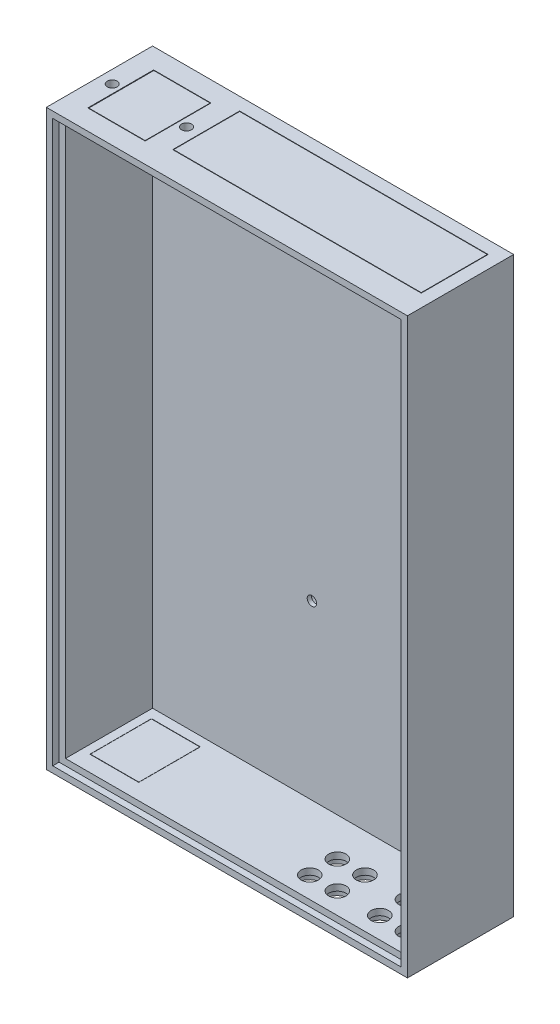
from build123d import *

# Parameters (mm, degrees)
SKETCH1_W           = 170
SKETCH1_H           = 270
BOSS_EXTRUDE1_DEPTH = 50
SKETCH2_W           = 158
SKETCH2_H           = 258
CUT_EXTRUDE1_DEPTH  = 44
SKETCH3_W           = 23
SKETCH3_H           = 29
CUT_EXTRUDE2_DEPTH  = 6
SKETCH4_W           = 28
SKETCH4_H           = 35
CUT_EXTRUDE3_DEPTH  = 4.5
CHAMFER1_SIZE       = 5
CHAMFER2_SIZE       = 5
SKETCH5_W           = 22.8
SKETCH5_H           = 28.7
BOSS_EXTRUDE2_DEPTH = 1.5
SKETCH6_W           = 0.854807692
SKETCH6_H           = 4.7625
CUT_EXTRUDE4_DEPTH  = 0.25
CUT_EXTRUDE5_DEPTH  = 0.25
CUT_EXTRUDE6_DEPTH  = 0.25
SKETCH9_W           = 117
SKETCH9_H           = 31.5
CUT_EXTRUDE7_DEPTH  = 6
SKETCH10_W          = 27
SKETCH10_H          = 31
CUT_EXTRUDE8_DEPTH  = 6
SKETCH11_R          = 2.35
CUT_EXTRUDE9_DEPTH  = 6
SKETCH12_R          = 2.35
CUT_EXTRUDE10_DEPTH = 6
SKETCH13_W          = 116.6
SKETCH13_H          = 31.1
BOSS_EXTRUDE3_DEPTH = 6
SKETCH14_W          = 26.5
SKETCH14_H          = 30.6
BOSS_EXTRUDE4_DEPTH = 6
SKETCH15_R          = 4.1
CUT_EXTRUDE11_DEPTH = 6
SKETCH16_R          = 5.75
CUT_EXTRUDE12_DEPTH = 3
CUT_EXTRUDE13_DEPTH = 0.25
SKETCH18_W          = 2.289663461
SKETCH18_H          = 1.102430555
CUT_EXTRUDE14_DEPTH = 0.25
SKETCH19_R          = 2.2
CUT_EXTRUDE15_DEPTH = 10
SKETCH20_R          = 3.75
CUT_EXTRUDE16_DEPTH = 4
SKETCH21_W          = 164
SKETCH21_H          = 264
CUT_EXTRUDE17_DEPTH = 3


with BuildPart() as part:
    # Sketch1 → Boss-Extrude1 (new body)
    with BuildSketch(Plane.XY):
        with Locations((42.589098532, -74.769392034)):
            Rectangle(SKETCH1_W, SKETCH1_H)
    extrude(amount=BOSS_EXTRUDE1_DEPTH)

    # Sketch2 → Cut-Extrude1 (cut)
    with BuildSketch(Plane.XY.offset(50)):
        with Locations((42.589098532, -74.769392034)):
            Rectangle(SKETCH2_W, SKETCH2_H)
    extrude(amount=-CUT_EXTRUDE1_DEPTH, mode=Mode.SUBTRACT)

    # Sketch3 → Cut-Extrude2 (cut)
    with BuildSketch(Plane.XZ.offset(209.769392034)):
        with Locations((-20.910901468, 25)):
            Rectangle(SKETCH3_W, SKETCH3_H)
    extrude(amount=-CUT_EXTRUDE2_DEPTH, mode=Mode.SUBTRACT)

    # Sketch4 → Cut-Extrude3 (cut)
    with BuildSketch(Plane.XZ.offset(209.769392034)):
        with Locations((-20.910901468, 25)):
            Rectangle(SKETCH4_W, SKETCH4_H)
    extrude(amount=-CUT_EXTRUDE3_DEPTH, mode=Mode.SUBTRACT)

    # Chamfer1
    # the kernel refuses this chamfer: 5 mm, written as the material it takes off along each edge
    with BuildSketch(Plane(origin=(-34.910901468, -209.769392034, 42.5), x_dir=(0, -0.0274958766105877, 0.9996219169112968), z_dir=(1, 0, 0))) as chamfer1_piece_1_section:
        Polygon((CHAMFER1_SIZE * 0.999621916911, -CHAMFER1_SIZE * 0.0274958766106), (-CHAMFER1_SIZE * 0.0274958766106, -CHAMFER1_SIZE * 0.999621916911), (0, 0), align=None)
    chamfer1_piece_1 = extrude(amount=28, mode=Mode.PRIVATE)
    chamfer1_piece_1 = split(chamfer1_piece_1, bisect_by=Plane(origin=(-20.910901468, -205.269392034, 44.179503735), z_dir=(0, -1, 0)), keep=Keep.TOP, mode=Mode.PRIVATE)
    add(chamfer1_piece_1, mode=Mode.SUBTRACT)

    # Chamfer2
    # the kernel refuses this chamfer: 5 mm, written as the material it takes off along each edge
    with BuildSketch(Plane(origin=(-6.910901468, -209.769392034, 7.5), x_dir=(0, 0.9996219169112968, 0.027495876610586282), z_dir=(-1, 0, 0))) as chamfer2_piece_1_section:
        Polygon((CHAMFER2_SIZE * 0.999621916911, CHAMFER2_SIZE * 0.0274958766106), (-CHAMFER2_SIZE * 0.0274958766106, CHAMFER2_SIZE * 0.999621916911), (0, 0), align=None)
    chamfer2_piece_1 = extrude(amount=28, mode=Mode.PRIVATE)
    chamfer2_piece_1 = split(chamfer2_piece_1, bisect_by=Plane(origin=(-20.910901468, -205.269392034, 5.820496265), z_dir=(0, -1, 0)), keep=Keep.TOP, mode=Mode.PRIVATE)
    add(chamfer2_piece_1, mode=Mode.SUBTRACT)

    # Sketch6 → Cut-Extrude4 (cut)
    with BuildSketch(Plane(origin=(0, -81.134696017, -81.134696017), x_dir=(1, 0, 0), z_dir=(0, -0.7071067811865436, -0.7071067811865515))):
        with Locations((-21.390321893, 178.542117658)):
            Rectangle(SKETCH6_W, SKETCH6_H)
    extrude(amount=-CUT_EXTRUDE4_DEPTH, mode=Mode.SUBTRACT)

    # Sketch7 → Cut-Extrude5 (cut)
    with BuildSketch(Plane(origin=(0, -106.134696017, 106.134696017), x_dir=(1, 0, 0), z_dir=(0, -0.7071067811865438, 0.7071067811865513))):
        with BuildLine():
            add(Edge.make_bspline(
                [(-21.393476353, -141.192692767), (-21.358996153, -141.193204636), (-21.291198867, -141.194211105), (-21.191346227, -141.205111993), (-21.095160527, -141.221580195), (-21.002265476, -141.244547593), (-20.913329743, -141.274944127), (-20.827706036, -141.311328257), (-20.746413523, -141.355608406), (-20.668415467, -141.405625108), (-20.593741911, -141.462251105), (-20.524187582, -141.526807666), (-20.458482271, -141.597809341), (-20.398048255, -141.676329548), (-20.341547205, -141.761654063), (-20.289164774, -141.853796415), (-20.241301963, -141.95320758), (-20.197422342, -142.060066953), (-20.158185047, -142.175976309), (-20.125135522, -142.30226518), (-20.096790024, -142.438962405), (-20.072864424, -142.586408245), (-20.054780537, -142.744798691), (-20.042591634, -142.914028515), (-20.034227031, -143.093771467), (-20.03354437, -143.217073656), (-20.033193651, -143.280420632)],
                knots=[0, 0, 0, 0, 0.879237366, 1.728815576, 2.559023295, 3.367336655, 4.166867292, 4.954216142, 5.737608147, 6.525189134, 7.316157332, 8.124696809, 8.942788509, 9.781158001, 10.649253743, 11.551476218, 12.482711956, 13.461909668, 14.496590415, 15.601789533, 16.789733467, 18.056700938, 19.410929216, 20.8549011, 22.384193279, 24, 24, 24, 24], degree=3))
            add(Edge.make_bspline(
                [(-20.033193651, -143.280420632), (-20.033572684, -143.34456015), (-20.034309138, -143.469182083), (-20.042243915, -143.650569056), (-20.055907975, -143.82102759), (-20.073519201, -143.98054005), (-20.097641764, -144.129022201), (-20.125892638, -144.26685851), (-20.15946384, -144.393999017), (-20.199993599, -144.510157245), (-20.243607615, -144.617204287), (-20.291601352, -144.716421623), (-20.343138286, -144.808077991), (-20.397036315, -144.893556151), (-20.456250328, -144.97033625), (-20.51789821, -145.041029213), (-20.584664222, -145.102942254), (-20.653737256, -145.159266095), (-20.727647737, -145.207941196), (-20.805633445, -145.250511637), (-20.88908473, -145.28504132), (-20.976480417, -145.315073395), (-21.069310184, -145.336633184), (-21.166098977, -145.353740168), (-21.267939524, -145.363194537), (-21.33727667, -145.364367413), (-21.37280578, -145.364968408)],
                knots=[0, 0, 0, 0, 1.643780988, 3.193836972, 4.651895693, 6.025988579, 7.305620092, 8.505800249, 9.631074763, 10.672816429, 11.65661981, 12.592235626, 13.49536222, 14.350718032, 15.179365177, 15.97804903, 16.751647189, 17.51006938, 18.259804725, 19.016521909, 19.783502495, 20.571750527, 21.382245291, 22.22305063, 23.089471752, 24, 24, 24, 24], degree=3))
            add(Edge.make_bspline(
                [(-21.37280578, -145.364968408), (-21.408333932, -145.364355821), (-21.477933057, -145.363155771), (-21.580048991, -145.353810465), (-21.677350716, -145.336563883), (-21.770914916, -145.314907875), (-21.860090396, -145.285107769), (-21.945304752, -145.249544982), (-22.025902759, -145.20724016), (-22.102107579, -145.15845165), (-22.173659028, -145.102504659), (-22.241669015, -145.039997602), (-22.305987098, -144.971088918), (-22.36563484, -144.895006774), (-22.421589097, -144.812766706), (-22.473266355, -144.723429575), (-22.520635559, -144.627125451), (-22.565178424, -144.523720098), (-22.603880536, -144.410987316), (-22.638323618, -144.287920417), (-22.666538486, -144.153493535), (-22.68923077, -144.007749858), (-22.707348276, -143.850998149), (-22.720825619, -143.683162749), (-22.728804469, -143.504165484), (-22.7295332, -143.381131747), (-22.729908394, -143.317786667)],
                knots=[0, 0, 0, 0, 0.917216111, 1.796812873, 2.643793957, 3.46689424, 4.273913431, 5.068098542, 5.848489301, 6.620921603, 7.401012384, 8.190319798, 9.003608147, 9.831726257, 10.68377682, 11.569763213, 12.493818149, 13.453288342, 14.474581811, 15.568529029, 16.750744269, 18.018426408, 19.375425659, 20.823733699, 22.36466933, 24, 24, 24, 24], degree=3))
            add(Edge.make_bspline(
                [(-22.729908394, -143.317786667), (-22.729228765, -143.229773666), (-22.727917413, -143.059951445), (-22.711298986, -142.814607712), (-22.686907351, -142.587829931), (-22.651081816, -142.379997444), (-22.606784038, -142.190340502), (-22.550058427, -142.020108464), (-22.485480445, -141.866945789), (-22.430451708, -141.776211298), (-22.40394936, -141.732512729)],
                knots=[0, 0, 0, 0, 1.288568992, 2.486310467, 3.599230591, 4.627010532, 5.572937695, 6.447898582, 7.252493626, 8, 8, 8, 8], degree=3))
            add(Edge.make_bspline(
                [(-22.40394936, -141.732512729), (-22.373133692, -141.689583269), (-22.31288299, -141.605647715), (-22.207532952, -141.495456023), (-22.094348053, -141.401214691), (-21.971003539, -141.325056487), (-21.839450156, -141.264998121), (-21.698558449, -141.222579573), (-21.54884871, -141.197864551), (-21.446040535, -141.194442439), (-21.393476353, -141.192692767)],
                knots=[0, 0, 0, 0, 1.058512271, 2.069600068, 3.047294572, 4.004278952, 4.967380941, 5.939006123, 6.946246673, 8, 8, 8, 8], degree=3))
        make_face()
        with BuildLine():
            add(Edge.make_bspline(
                [(-21.375985868, -141.905032511), (-21.407156255, -141.906509925), (-21.46826676, -141.909406442), (-21.556941013, -141.933993779), (-21.640555298, -141.971970248), (-21.704158451, -142.017668991), (-21.751764779, -142.061476716), (-21.785027661, -142.101121283), (-21.817104469, -142.145361762), (-21.845436321, -142.196194499), (-21.872188984, -142.251793013), (-21.8983344, -142.312409689), (-21.919766776, -142.379533404), (-21.940823518, -142.452021031), (-21.959271188, -142.531876661), (-21.974726291, -142.619753025), (-21.988534067, -142.716221593), (-21.998165156, -142.82134555), (-22.00714422, -142.935014911), (-22.013580839, -143.057482888), (-22.016271828, -143.188716441), (-22.017127212, -143.279095042), (-22.017568651, -143.325736888)],
                knots=[0, 0, 0, 0, 1.076674018, 2.110852608, 3.161083442, 4.239746716, 4.804137807, 5.395870207, 6.026861976, 6.692161227, 7.405688833, 8.16177676, 8.973626916, 9.841385931, 10.773283133, 11.807421078, 12.927755683, 14.143907515, 15.458935494, 16.872852025, 18.386167141, 20, 20, 20, 20], degree=3))
            add(Edge.make_bspline(
                [(-22.017568651, -143.325736888), (-22.016842095, -143.386163654), (-22.015448871, -143.50203646), (-22.008151815, -143.668665588), (-21.993525472, -143.820311513), (-21.975333254, -143.958001994), (-21.94978154, -144.080844071), (-21.92038264, -144.189999946), (-21.884077612, -144.284078144), (-21.842120158, -144.36443925), (-21.795650386, -144.432802275), (-21.745205404, -144.490911155), (-21.692502684, -144.541230703), (-21.635897202, -144.582104651), (-21.575524001, -144.613428562), (-21.511887087, -144.635959463), (-21.44494602, -144.649751567), (-21.399105467, -144.651664088), (-21.375985868, -144.652628665)],
                knots=[0, 0, 0, 0, 1.771748488, 3.397459088, 4.888034009, 6.237357457, 7.467047327, 8.564189669, 9.548206622, 10.417051504, 11.216568818, 11.965764335, 12.669334354, 13.348544111, 14.005342236, 14.656555988, 15.322436492, 16, 16, 16, 16], degree=3))
            add(Edge.make_bspline(
                [(-21.375985868, -144.652628665), (-21.353659661, -144.65196863), (-21.309947724, -144.650676363), (-21.246205931, -144.637411422), (-21.185927161, -144.615845509), (-21.129293416, -144.585339011), (-21.076102125, -144.546545331), (-21.026613254, -144.499293994), (-20.981200038, -144.443114012), (-20.954742092, -144.401420158), (-20.941108815, -144.379936107)],
                knots=[0, 0, 0, 0, 0.992283464, 1.942767638, 2.88273346, 3.832339453, 4.79467288, 5.803907806, 6.868395428, 8, 8, 8, 8], degree=3))
            add(Edge.make_bspline(
                [(-20.941108815, -144.379936107), (-20.925057928, -144.350578838), (-20.891400519, -144.289019025), (-20.852452108, -144.185139137), (-20.819667506, -144.067979792), (-20.791450278, -143.93717638), (-20.772151416, -143.792212995), (-20.755531259, -143.634008863), (-20.747514944, -143.461767332), (-20.746211047, -143.342437778), (-20.745533394, -143.280420632)],
                knots=[0, 0, 0, 0, 0.710965849, 1.490837728, 2.352621235, 3.297892224, 4.334225155, 5.461620853, 6.680770821, 8, 8, 8, 8], degree=3))
            add(Edge.make_bspline(
                [(-20.745533394, -143.280420632), (-20.745795157, -143.217865147), (-20.746299005, -143.097456518), (-20.755543162, -142.924595767), (-20.768416356, -142.766716159), (-20.787246123, -142.624170176), (-20.81147404, -142.496611778), (-20.84133504, -142.384049305), (-20.876538937, -142.286260917), (-20.918286564, -142.203344122), (-20.964524655, -142.132876221), (-21.0136078, -142.072420228), (-21.065743542, -142.020804427), (-21.120844694, -141.977834577), (-21.180186591, -141.945002389), (-21.242635726, -141.921820149), (-21.308320123, -141.907795671), (-21.353126181, -141.905965996), (-21.375985868, -141.905032511)],
                knots=[0, 0, 0, 0, 1.793836731, 3.452829483, 4.963243077, 6.335886805, 7.574563692, 8.684454726, 9.672768357, 10.54971625, 11.340229787, 12.085688095, 12.778991901, 13.440269426, 14.083255152, 14.715733572, 15.344777694, 16, 16, 16, 16], degree=3))
        make_face(mode=Mode.SUBTRACT)
    extrude(amount=-CUT_EXTRUDE5_DEPTH, mode=Mode.SUBTRACT)

    # Sketch8 → Cut-Extrude6 (cut)
    # profile 1 of 5: a face of its own
    with BuildSketch(Plane.XZ.offset(209.769392034)):
        Polygon((11.588851494, 27.702942042), (13.056992185, 27.702942042), (13.056992185, 22.411275375), (12.107205861, 22.411275375), (12.107205861, 26.820997597), (11.021735775, 26.820997597), align=None)
    # profile 2 of 5: a face of its own
    with BuildSketch(Plane.XZ.offset(209.769392034)):
        with BuildLine():
            Line((15.702825519, 25.939053153), (14.753039194, 25.939053153))
            add(Edge.make_bspline(
                [(14.753039194, 25.939053153), (14.757141175, 26.010899464), (14.765156201, 26.151282841), (14.797037947, 26.355194192), (14.839758392, 26.547867995), (14.896774497, 26.728630258), (14.968418964, 26.897415296), (15.052848195, 27.054798506), (15.152219167, 27.199951264), (15.264416938, 27.33217356), (15.387536698, 27.450791402), (15.51902236, 27.555965433), (15.660885175, 27.642752396), (15.810533193, 27.714170031), (15.967940932, 27.771229404), (16.134597716, 27.809378212), (16.309060541, 27.835212958), (16.428494473, 27.837473602), (16.489367319, 27.838625802)],
                knots=[0, 0, 0, 0, 1.199038563, 2.342849363, 3.436047546, 4.486744587, 5.497670872, 6.488682221, 7.459191391, 8.424610317, 9.374430501, 10.305433194, 11.225809216, 12.140057399, 13.06607119, 14.010487599, 14.985989317, 16, 16, 16, 16], degree=3))
            add(Edge.make_bspline(
                [(16.489367319, 27.838625802), (16.564087874, 27.836294324), (16.709959908, 27.831742732), (16.921923544, 27.792916142), (17.119874405, 27.727972669), (17.303668599, 27.637229511), (17.471741453, 27.52194984), (17.624065097, 27.3844977), (17.756033021, 27.221989273), (17.86848194, 27.041186268), (17.961913552, 26.849741331), (18.027386534, 26.651779328), (18.07042122, 26.452553367), (18.075011136, 26.318404689), (18.077291331, 26.25176182)],
                knots=[0, 0, 0, 0, 1.075374347, 2.099382735, 3.09057751, 4.06680945, 5.040638231, 6.016817125, 7.011024321, 8.044445721, 9.0776792, 10.070479129, 11.0414456, 12, 12, 12, 12], degree=3))
            add(Edge.make_bspline(
                [(18.077291331, 26.25176182), (18.076403543, 26.211451503), (18.074616646, 26.130316792), (18.062192114, 26.007540061), (18.043552861, 25.882477606), (18.015449409, 25.755236657), (17.980402101, 25.625781545), (17.937884651, 25.493724857), (17.886910824, 25.359815304), (17.828331271, 25.222545759), (17.758445715, 25.081470561), (17.6770737, 24.934474937), (17.582055427, 24.781689284), (17.474538597, 24.622250924), (17.354001028, 24.456411318), (17.219854293, 24.284670024), (17.07364345, 24.106421882), (16.969873501, 23.987273003), (16.916559159, 23.92605736)],
                knots=[0, 0, 0, 0, 0.728284026, 1.46585585, 2.227944881, 3.01186502, 3.81876927, 4.650621989, 5.517437689, 6.406905708, 7.346299482, 8.360816762, 9.441613733, 10.596154504, 11.834900912, 13.145207542, 14.533280747, 16, 16, 16, 16], degree=3))
            Line((16.916559159, 23.92605736), (16.364283852, 23.29321982))
            Line((16.364283852, 23.29321982), (18.145133211, 23.29321982))
            Line((18.145133211, 23.29321982), (18.145133211, 22.411275375))
            Line((18.145133211, 22.411275375), (14.617355433, 22.411275375))
            Line((14.617355433, 22.411275375), (14.617355433, 22.892528714))
            Line((14.617355433, 22.892528714), (16.184078857, 24.559954929))
            add(Edge.make_bspline(
                [(16.184078857, 24.559954929), (16.229439527, 24.608594269), (16.317289691, 24.702794248), (16.442291422, 24.841136938), (16.555406946, 24.972420848), (16.654290721, 25.098043888), (16.744132041, 25.213931357), (16.820924887, 25.323576248), (16.885371856, 25.425987332), (16.95533818, 25.549477214), (17.021783189, 25.696760872), (17.082750506, 25.866437686), (17.119914305, 26.028609642), (17.125044084, 26.134284375), (17.127505006, 26.184979969)],
                knots=[0, 0, 0, 0, 1.246127091, 2.413378631, 3.493388633, 4.492180848, 5.408488754, 6.240484944, 6.999099869, 7.674939598, 8.898438119, 10.020720584, 11.050475521, 12, 12, 12, 12], degree=3))
            add(Edge.make_bspline(
                [(17.127505006, 26.184979969), (17.125665034, 26.234024045), (17.122099794, 26.329054806), (17.082920698, 26.464235556), (17.022223082, 26.586627926), (16.936691569, 26.692574694), (16.833086119, 26.779638178), (16.71336029, 26.844393552), (16.578490199, 26.881757106), (16.483943695, 26.886433688), (16.43530582, 26.888839478)],
                knots=[0, 0, 0, 0, 1.062038974, 2.057870785, 3.028805853, 4.01125022, 4.991535629, 5.949134679, 6.94496649, 8, 8, 8, 8], degree=3))
            add(Edge.make_bspline(
                [(16.43530582, 26.888839478), (16.410178875, 26.88795075), (16.360712448, 26.886201147), (16.288000666, 26.874554514), (16.218810182, 26.854028538), (16.152370867, 26.82652662), (16.089391778, 26.79007263), (16.03003177, 26.74513728), (15.973665408, 26.692862478), (15.920551213, 26.633411682), (15.872210361, 26.567064575), (15.829274194, 26.494427104), (15.793773131, 26.415544357), (15.762516705, 26.331457706), (15.738410253, 26.241263992), (15.720857766, 26.145503014), (15.707513782, 26.044330563), (15.704416702, 25.974784017), (15.702825519, 25.939053153)],
                knots=[0, 0, 0, 0, 0.903469896, 1.778625579, 2.63899355, 3.493148037, 4.358286772, 5.247621495, 6.164656832, 7.118446693, 8.109501108, 9.111810964, 10.146451449, 11.215617525, 12.33435995, 13.498009769, 14.714554818, 16, 16, 16, 16], degree=3))
        make_face()
    # profile 3 of 5: a face of its own
    with BuildSketch(Plane.XZ.offset(209.769392034)):
        Polygon((18.721789194, 27.702942042), (19.736237311, 27.702942042), (21.096255006, 23.944077859), (22.459452789, 27.702942042), (23.470720818, 27.702942042), (21.552067639, 22.411275375), (20.637262284, 22.411275375), align=None)
    # profile 4 of 5: a face of its own
    with BuildSketch(Plane.XZ.offset(209.769392034)):
        with BuildLine():
            Line((26.354000732, 27.702942042), (27.414030113, 27.702942042))
            add(Edge.make_bspline(
                [(27.414030113, 27.702942042), (27.483291057, 27.702632015), (27.616909937, 27.702033908), (27.809599356, 27.694781071), (27.987364779, 27.681783544), (28.150165365, 27.665720657), (28.297934175, 27.643201114), (28.43085626, 27.617384221), (28.548959204, 27.585931732), (28.653574793, 27.548598063), (28.747463905, 27.504583126), (28.836313288, 27.457704076), (28.918114934, 27.401755583), (28.996997621, 27.342767539), (29.068451488, 27.275104837), (29.136934257, 27.20327053), (29.199545495, 27.124415727), (29.25657532, 27.039494944), (29.308310158, 26.950077155), (29.353509174, 26.856002507), (29.390172084, 26.757122136), (29.420927707, 26.654075687), (29.445630923, 26.54686765), (29.46207417, 26.434838686), (29.47324325, 26.318771025), (29.474228767, 26.239775301), (29.474727228, 26.19982038)],
                knots=[0, 0, 0, 0, 1.698747864, 3.27724071, 4.728299578, 6.070144658, 7.288476769, 8.393259625, 9.389771311, 10.283485332, 11.113357557, 11.931608583, 12.74405601, 13.541433047, 14.344816069, 15.154114104, 15.974336324, 16.810834471, 17.661136416, 18.50621059, 19.367396281, 20.244825668, 21.142564693, 22.063065223, 23.020325768, 24, 24, 24, 24], degree=3))
            add(Edge.make_bspline(
                [(29.474727228, 26.19982038), (29.474006018, 26.155619203), (29.472588751, 26.068758458), (29.458694972, 25.941431263), (29.434960007, 25.82003631), (29.40393965, 25.703549855), (29.360683967, 25.593888357), (29.311266382, 25.48843526), (29.250467076, 25.390147145), (29.18099415, 25.297794545), (29.105121789, 25.210626591), (29.021048786, 25.131160093), (28.930377609, 25.05885333), (28.833633121, 24.992948521), (28.730452115, 24.933578611), (28.620909039, 24.880187665), (28.504255873, 24.83448329), (28.423022118, 24.810580272), (28.381836937, 24.79846154)],
                knots=[0, 0, 0, 0, 1.102006807, 2.165578795, 3.188629044, 4.184801286, 5.166646146, 6.124351954, 7.085497154, 8.042432466, 9.003981491, 9.963833307, 10.922997304, 11.89326795, 12.880200226, 13.889073926, 14.929769137, 16, 16, 16, 16], degree=3))
            add(Edge.make_bspline(
                [(28.381836937, 24.79846154), (28.354710008, 24.791712316), (28.295944344, 24.777091323), (28.19870331, 24.762247346), (28.086643229, 24.748599222), (27.959401737, 24.736870312), (27.816905476, 24.728897386), (27.659292419, 24.722670885), (27.486491139, 24.718143576), (27.366331962, 24.717982927), (27.303787057, 24.717899307)],
                knots=[0, 0, 0, 0, 0.618981996, 1.340914327, 2.176866532, 3.120127938, 4.170906482, 5.338178032, 6.614476169, 8, 8, 8, 8], degree=3))
            Line((27.303787057, 24.717899307), (27.303787057, 22.411275375))
            Line((27.303787057, 22.411275375), (26.354000732, 22.411275375))
            Line((26.354000732, 22.411275375), (26.354000732, 27.702942042))
        make_face()
        with BuildLine():
            Line((27.303787057, 25.667685631), (27.639816371, 25.667685631))
            add(Edge.make_bspline(
                [(27.639816371, 25.667685631), (27.700962209, 25.668073344), (27.813471461, 25.66878674), (27.967119368, 25.67910286), (28.090593782, 25.69485766), (28.188140862, 25.717453687), (28.26516352, 25.751746149), (28.331590741, 25.79141607), (28.388567065, 25.841577597), (28.437900175, 25.898895724), (28.477340509, 25.964757124), (28.504690327, 26.038089373), (28.522456231, 26.117351682), (28.524097077, 26.172513003), (28.524940903, 26.20088041)],
                knots=[0, 0, 0, 0, 1.8619151, 3.425951444, 4.686033666, 5.651700536, 6.461346321, 7.243864085, 7.999046032, 8.762387399, 9.539336099, 10.322741239, 11.137448474, 12, 12, 12, 12], degree=3))
            add(Edge.make_bspline(
                [(28.524940903, 26.20088041), (28.524105757, 26.225664644), (28.522485373, 26.273752016), (28.510581591, 26.343154022), (28.491610385, 26.407851009), (28.464121838, 26.467167302), (28.428585655, 26.521002113), (28.385259858, 26.569334235), (28.334700399, 26.613198742), (28.295665542, 26.636416895), (28.275833999, 26.648212808)],
                knots=[0, 0, 0, 0, 1.102301479, 2.1387299, 3.123554645, 4.094223062, 5.036071848, 5.982632524, 6.975082478, 8, 8, 8, 8], degree=3))
            add(Edge.make_bspline(
                [(28.275833999, 26.648212808), (28.259035537, 26.656708272), (28.223469752, 26.67469491), (28.162897771, 26.695605691), (28.09299863, 26.713246239), (28.013300431, 26.727887723), (27.924121112, 26.739251035), (27.825476586, 26.747941126), (27.717221687, 26.75143575), (27.641936883, 26.752566582), (27.602715342, 26.753155717)],
                knots=[0, 0, 0, 0, 0.656809284, 1.390599849, 2.23162475, 3.173112763, 4.218524733, 5.370385145, 6.63003504, 8, 8, 8, 8], degree=3))
            Line((27.602715342, 26.753155717), (27.303787057, 26.753155717))
            Line((27.303787057, 26.753155717), (27.303787057, 25.667685631))
        make_face(mode=Mode.SUBTRACT)
    # profile 5 of 5: a face of its own
    with BuildSketch(Plane.XZ.offset(209.769392034)):
        with BuildLine():
            Line((33.138188767, 26.995902445), (32.427969082, 26.346104435))
            add(Edge.make_bspline(
                [(32.427969082, 26.346104435), (32.397546316, 26.389018909), (32.339138848, 26.471408715), (32.244466434, 26.581730607), (32.150221515, 26.67584339), (32.055530969, 26.753353906), (31.959555494, 26.81379122), (31.86246169, 26.856581507), (31.764800009, 26.883783697), (31.699186435, 26.887171025), (31.666867987, 26.888839478)],
                knots=[0, 0, 0, 0, 1.299362458, 2.494594718, 3.587462134, 4.587049575, 5.512617175, 6.380583204, 7.202344345, 8, 8, 8, 8], degree=3))
            add(Edge.make_bspline(
                [(31.666867987, 26.888839478), (31.636722265, 26.887782269), (31.578518796, 26.885741078), (31.495545434, 26.865451786), (31.421880501, 26.830435449), (31.357595892, 26.784648641), (31.306672997, 26.729486153), (31.266015014, 26.671634887), (31.243121153, 26.607780173), (31.240107871, 26.563922179), (31.238616117, 26.54220987)],
                knots=[0, 0, 0, 0, 1.185010067, 2.2879431, 3.333075148, 4.379039566, 5.372662701, 6.27520591, 7.14612461, 8, 8, 8, 8], degree=3))
            add(Edge.make_bspline(
                [(31.238616117, 26.54220987), (31.239550923, 26.520184461), (31.241433493, 26.475828346), (31.259616558, 26.410818936), (31.287023628, 26.347297175), (31.313212203, 26.308628457), (31.326598556, 26.288862848)],
                knots=[0, 0, 0, 0, 0.967525499, 1.948461899, 2.951351359, 4, 4, 4, 4], degree=3))
            add(Edge.make_bspline(
                [(31.326598556, 26.288862848), (31.338768198, 26.273499248), (31.366781109, 26.238134268), (31.420195992, 26.182121652), (31.487273868, 26.113501296), (31.570596033, 26.03463285), (31.666703556, 25.942679899), (31.780051145, 25.841257147), (31.907376161, 25.72722365), (31.997875833, 25.647814852), (32.045298475, 25.606203927)],
                knots=[0, 0, 0, 0, 0.473873513, 1.090794244, 1.870441696, 2.795289791, 3.865433203, 5.087734844, 6.473946851, 8, 8, 8, 8], degree=3))
            add(Edge.make_bspline(
                [(32.045298475, 25.606203927), (32.089811447, 25.567680196), (32.174287819, 25.494570157), (32.294480921, 25.390802195), (32.40011064, 25.29744469), (32.492715759, 25.215898738), (32.570892476, 25.145308735), (32.634969445, 25.085337263), (32.685729259, 25.037151855), (32.71458324, 25.008047839), (32.726897367, 24.995627004)],
                knots=[0, 0, 0, 0, 1.543621617, 2.929473131, 4.163658386, 5.240097082, 6.164993805, 6.925417477, 7.541396219, 8, 8, 8, 8], degree=3))
            add(Edge.make_bspline(
                [(32.726897367, 24.995627004), (32.773614596, 24.945068957), (32.863421516, 24.847878636), (32.980138854, 24.697264203), (33.076200998, 24.550233806), (33.150516494, 24.404020828), (33.206642546, 24.256515709), (33.246212156, 24.104100892), (33.269910659, 23.945183739), (33.272541746, 23.836742182), (33.273872527, 23.781893364)],
                knots=[0, 0, 0, 0, 1.206664779, 2.319633467, 3.337109185, 4.282041471, 5.190008762, 6.099243693, 7.03861361, 8, 8, 8, 8], degree=3))
            add(Edge.make_bspline(
                [(33.273872527, 23.781893364), (33.272925311, 23.728449917), (33.271066838, 23.623591886), (33.248304102, 23.470147776), (33.215845777, 23.323295103), (33.165659512, 23.184631832), (33.10449279, 23.051881848), (33.02781147, 22.927112973), (32.937759774, 22.809062495), (32.834546703, 22.699840711), (32.720380791, 22.600729512), (32.597927, 22.512498382), (32.465987916, 22.439652345), (32.325690805, 22.37966883), (32.177110764, 22.333468725), (32.020424799, 22.299322542), (31.855393246, 22.27882854), (31.742542292, 22.276686136), (31.684888486, 22.275591614)],
                knots=[0, 0, 0, 0, 1.043214005, 2.046824704, 3.02475056, 3.976699089, 4.921714032, 5.875962561, 6.831408892, 7.817874052, 8.806269674, 9.781291748, 10.760897367, 11.74438705, 12.757449933, 13.795994037, 14.874007457, 16, 16, 16, 16], degree=3))
            add(Edge.make_bspline(
                [(31.684888486, 22.275591614), (31.639630739, 22.276394517), (31.549994445, 22.277984725), (31.417884099, 22.290967446), (31.290316625, 22.311920176), (31.167435718, 22.341951699), (31.048687777, 22.380005711), (30.934067924, 22.426487228), (30.82436742, 22.482116698), (30.718756217, 22.545750156), (30.617747717, 22.619636984), (30.520064707, 22.702266588), (30.426677467, 22.794909849), (30.337137478, 22.89734767), (30.252017641, 23.009870129), (30.168531679, 23.130910144), (30.090389958, 23.262714052), (30.042118341, 23.35517556), (30.017462271, 23.402402846)],
                knots=[0, 0, 0, 0, 1.016823716, 2.013894106, 2.979844003, 3.91962641, 4.853723003, 5.779685073, 6.695824784, 7.614987388, 8.547259901, 9.504950863, 10.487499108, 11.500346958, 12.559593716, 13.656357062, 14.802919212, 16, 16, 16, 16], degree=3))
            Line((30.017462271, 23.402402846), (30.852765422, 23.903796743))
            add(Edge.make_bspline(
                [(30.852765422, 23.903796743), (30.883606481, 23.850187603), (30.942731427, 23.7474143), (31.042924175, 23.609325342), (31.145566531, 23.491075007), (31.253031493, 23.394753378), (31.364012328, 23.31907251), (31.479045099, 23.264985712), (31.598210626, 23.231506045), (31.67938077, 23.227417404), (31.719869456, 23.225377939)],
                knots=[0, 0, 0, 0, 1.283663364, 2.460892379, 3.537111102, 4.529833553, 5.449777664, 6.316464042, 7.160231139, 8, 8, 8, 8], degree=3))
            add(Edge.make_bspline(
                [(31.719869456, 23.225377939), (31.761052246, 23.227043477), (31.840952857, 23.230274863), (31.955000755, 23.260122202), (32.059564186, 23.306984714), (32.149948044, 23.373851057), (32.226479396, 23.451024979), (32.282963927, 23.536884496), (32.31844789, 23.629782421), (32.322199405, 23.69431543), (32.324086202, 23.726771836)],
                knots=[0, 0, 0, 0, 1.13588714, 2.203786484, 3.234766741, 4.283437687, 5.291419208, 6.222934724, 7.106237994, 8, 8, 8, 8], degree=3))
            add(Edge.make_bspline(
                [(32.324086202, 23.726771836), (32.322343822, 23.75696724), (32.318804344, 23.818306313), (32.292733639, 23.90950765), (32.251977176, 24.000667511), (32.203759405, 24.075439295), (32.154691786, 24.138043684), (32.107772075, 24.192287554), (32.050636278, 24.252217534), (31.983429268, 24.317909012), (31.907039023, 24.389940286), (31.821401195, 24.468304302), (31.725535141, 24.552310768), (31.657776824, 24.609535142), (31.622346753, 24.639457133)],
                knots=[0, 0, 0, 0, 0.916159276, 1.861089862, 2.860218735, 3.940849679, 4.552606315, 5.27541173, 6.11797699, 7.06649574, 8.129236253, 9.306560635, 10.591630461, 12, 12, 12, 12], degree=3))
            add(Edge.make_bspline(
                [(31.622346753, 24.639457133), (31.554992777, 24.696445055), (31.425720111, 24.805822127), (31.243041432, 24.967368619), (31.078431586, 25.118348618), (30.93331232, 25.260628567), (30.805834589, 25.391580885), (30.696861729, 25.512269217), (30.607590856, 25.623624508), (30.513652511, 25.755517399), (30.424392301, 25.916237949), (30.34724615, 26.109603402), (30.297196984, 26.30294432), (30.291589671, 26.432742763), (30.288829792, 26.496628607)],
                knots=[0, 0, 0, 0, 1.345494975, 2.582412109, 3.71882943, 4.751509156, 5.681369928, 6.505683931, 7.230279997, 7.856715994, 8.973648664, 10.023341002, 11.027102913, 12, 12, 12, 12], degree=3))
            add(Edge.make_bspline(
                [(30.288829792, 26.496628607), (30.289977622, 26.541933018), (30.29223897, 26.631187575), (30.312410542, 26.762423396), (30.342557725, 26.889054936), (30.38634009, 27.010620186), (30.443164314, 27.12696688), (30.512175126, 27.238664585), (30.594444134, 27.34468526), (30.687155752, 27.444958621), (30.789300218, 27.536597062), (30.89845456, 27.617477168), (31.014000957, 27.685789682), (31.135232552, 27.742459873), (31.262900568, 27.785837304), (31.39606448, 27.816585389), (31.534915288, 27.834873369), (31.62935861, 27.837359408), (31.67746828, 27.838625802)],
                knots=[0, 0, 0, 0, 1.010766082, 1.991317756, 2.957454644, 3.913069143, 4.869106762, 5.843196583, 6.838735724, 7.860187025, 8.887984031, 9.89767229, 10.887916223, 11.879572884, 12.879850636, 13.892031539, 14.926195476, 16, 16, 16, 16], degree=3))
            add(Edge.make_bspline(
                [(31.67746828, 27.838625802), (31.739816031, 27.836344989), (31.864019382, 27.831801366), (32.047657619, 27.796271717), (32.227027771, 27.740397602), (32.3715676, 27.672991629), (32.486575245, 27.607695432), (32.574717861, 27.547578918), (32.664407718, 27.478712221), (32.756368107, 27.400878323), (32.848890264, 27.312610731), (32.944605035, 27.216010725), (33.042208189, 27.110243455), (33.105634764, 27.034683807), (33.138188767, 26.995902445)],
                knots=[0, 0, 0, 0, 1.282922637, 2.555718331, 3.837320111, 5.142675274, 5.830281639, 6.55870424, 7.337177975, 8.157850921, 9.037902056, 9.96903443, 10.957596896, 12, 12, 12, 12], degree=3))
        make_face()
    extrude(amount=-CUT_EXTRUDE6_DEPTH, mode=Mode.SUBTRACT)

    # Sketch9 → Cut-Extrude7 (cut)
    with BuildSketch(Plane.XZ.offset(-54.230607966)):
        with Locations((63.089098532, 21.75)):
            Rectangle(SKETCH9_W, SKETCH9_H)
    extrude(amount=-CUT_EXTRUDE7_DEPTH, mode=Mode.SUBTRACT)

    # Sketch10 → Cut-Extrude8 (cut)
    with BuildSketch(Plane(origin=(0, 60.230607966, 0), x_dir=(1, 0, 0), z_dir=(0, 1, 0))):
        with Locations((-18.910901468, -25)):
            Rectangle(SKETCH10_W, SKETCH10_H)
    extrude(amount=-CUT_EXTRUDE8_DEPTH, mode=Mode.SUBTRACT)

    # Sketch11 → Cut-Extrude9 (cut)
    with BuildSketch(Plane(origin=(0, 60.230607966, 0), x_dir=(1, 0, 0), z_dir=(0, 1, 0))):
        with Locations(Location((-1.410901468, -25, 0), (0, 0, 270))):
            Circle(SKETCH11_R)
    extrude(amount=-CUT_EXTRUDE9_DEPTH, mode=Mode.SUBTRACT)

    # Sketch12 → Cut-Extrude10 (cut)
    with BuildSketch(Plane(origin=(0, 60.230607966, 0), x_dir=(1, 0, 0), z_dir=(0, 1, 0))):
        with Locations(Location((-36.410901468, -25, 0), (0, 0, 270))):
            Circle(SKETCH12_R)
    extrude(amount=-CUT_EXTRUDE10_DEPTH, mode=Mode.SUBTRACT)

    # Sketch15 → Cut-Extrude11 (cut)
    with BuildSketch(Plane.XZ.offset(209.769392034)):
        with Locations(Location((114.589098532, 37, 0), (0, 0, 270))):
            Circle(SKETCH15_R)
        with Locations(Location((101.589098532, 37, 0), (0, 0, 270))):
            Circle(SKETCH15_R)
        with Locations(Location((81.589098532, 37, 0), (0, 0, 270))):
            Circle(SKETCH15_R)
        with Locations(Location((68.589098532, 37, 0), (0, 0, 270))):
            Circle(SKETCH15_R)
        with Locations(Location((114.589098532, 24, 0), (0, 0, 270))):
            Circle(SKETCH15_R)
        with Locations(Location((101.589098532, 24, 0), (0, 0, 270))):
            Circle(SKETCH15_R)
        with Locations(Location((81.589098532, 24, 0), (0, 0, 270))):
            Circle(SKETCH15_R)
        with Locations(Location((68.589098532, 24, 0), (0, 0, 270))):
            Circle(SKETCH15_R)
    extrude(amount=-CUT_EXTRUDE11_DEPTH, mode=Mode.SUBTRACT)

    # Sketch16 → Cut-Extrude12 (cut)
    with BuildSketch(Plane.XZ.offset(209.769392034)):
        with Locations(Location((114.589098532, 37, 0), (0, 0, 270))):
            Circle(SKETCH16_R)
        with Locations(Location((114.589098532, 24, 0), (0, 0, 270))):
            Circle(SKETCH16_R)
        with Locations(Location((101.589098532, 37, 0), (0, 0, 270))):
            Circle(SKETCH16_R)
        with Locations(Location((101.589098532, 24, 0), (0, 0, 270))):
            Circle(SKETCH16_R)
        with Locations(Location((81.589098532, 37, 0), (0, 0, 270))):
            Circle(SKETCH16_R)
        with Locations(Location((68.589098532, 37, 0), (0, 0, 270))):
            Circle(SKETCH16_R)
        with Locations(Location((81.589098532, 24, 0), (0, 0, 270))):
            Circle(SKETCH16_R)
        with Locations(Location((68.589098532, 24, 0), (0, 0, 270))):
            Circle(SKETCH16_R)
    extrude(amount=-CUT_EXTRUDE12_DEPTH, mode=Mode.SUBTRACT)

    # Sketch17 → Cut-Extrude13 (cut)
    with BuildSketch(Plane.XZ.offset(209.769392034)):
        Polygon((91.179124912, 37.58846879), (91.179124912, 39.199713448), (92.281555467, 39.199713448), (92.281555467, 37.58846879), (93.977602476, 37.58846879), (93.977602476, 36.486038234), (92.281555467, 36.486038234), (92.281555467, 34.874793576), (91.179124912, 34.874793576), (91.179124912, 36.486038234), (89.483077903, 36.486038234), (89.483077903, 37.58846879), align=None)
    extrude(amount=-CUT_EXTRUDE13_DEPTH, mode=Mode.SUBTRACT)

    # Sketch18 → Cut-Extrude14 (cut)
    with BuildSketch(Plane.XZ.offset(209.769392034)):
        with Locations((91.702338998, 24.560282122)):
            Rectangle(SKETCH18_W, SKETCH18_H)
    extrude(amount=-CUT_EXTRUDE14_DEPTH, mode=Mode.SUBTRACT)

    # Sketch19 → Cut-Extrude15 (cut)
    with BuildSketch(Plane.XY.offset(6)):
        with Locations((88.589098532, 27.480607966)):
            Circle(SKETCH19_R)
        with Locations((38.589098532, 27.480607966)):
            Circle(SKETCH19_R)
        with Locations((88.589098532, -122.519392034)):
            Circle(SKETCH19_R)
        with Locations((38.589098532, -122.519392034)):
            Circle(SKETCH19_R)
    extrude(amount=-CUT_EXTRUDE15_DEPTH, mode=Mode.SUBTRACT)

    # Sketch20 → Cut-Extrude16 (cut)
    with BuildSketch(Plane(origin=(0, 0, 0), x_dir=(-1, 0, 0), z_dir=(0, 0, -1))):
        with Locations((-88.589098532, 27.480607966)):
            Circle(SKETCH20_R)
        with Locations((-38.589098532, 27.480607966)):
            Circle(SKETCH20_R)
        with Locations((-38.589098532, -122.519392034)):
            Circle(SKETCH20_R)
        with Locations((-88.589098532, -122.519392034)):
            Circle(SKETCH20_R)
    extrude(amount=-CUT_EXTRUDE16_DEPTH, mode=Mode.SUBTRACT)

    # Sketch21 → Cut-Extrude17 (cut)
    with BuildSketch(Plane.XY.offset(50)):
        with Locations((42.589098532, -74.769392034)):
            Rectangle(SKETCH21_W, SKETCH21_H)
    extrude(amount=-CUT_EXTRUDE17_DEPTH, mode=Mode.SUBTRACT)


with BuildPart() as body_2:
    # Sketch5 → Boss-Extrude2 (new body)
    with BuildSketch(Plane.XZ.offset(205.269392034)):
        with Locations((-20.910901468, 25)):
            Rectangle(SKETCH5_W, SKETCH5_H)
    extrude(amount=-BOSS_EXTRUDE2_DEPTH)


with BuildPart() as body_3:
    # Sketch13 → Boss-Extrude3 (new body)
    with BuildSketch(Plane(origin=(0, 60.230607966, 0), x_dir=(1, 0, 0), z_dir=(0, 1, 0))):
        with Locations((63.089098532, -21.75)):
            Rectangle(SKETCH13_W, SKETCH13_H)
    extrude(amount=-BOSS_EXTRUDE3_DEPTH)


with BuildPart() as body_4:
    # Sketch14 → Boss-Extrude4 (new body)
    with BuildSketch(Plane(origin=(0, 60.230607966, 0), x_dir=(1, 0, 0), z_dir=(0, 1, 0))):
        with Locations((-18.860901468, -25)):
            Rectangle(SKETCH14_W, SKETCH14_H)
    extrude(amount=-BOSS_EXTRUDE4_DEPTH)


solid = Compound([part.part, body_2.part, body_3.part, body_4.part])
